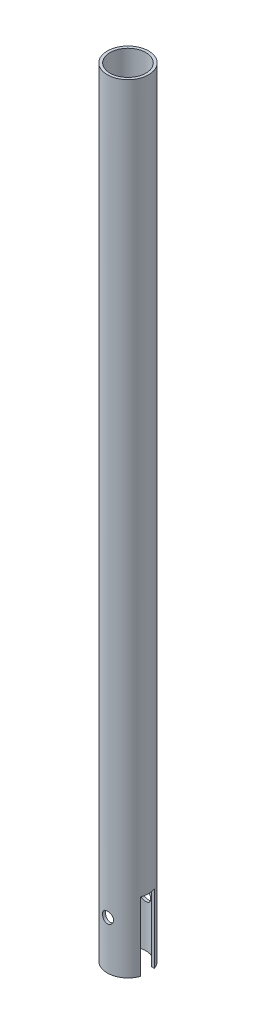
from build123d import *

# Parameters (mm, degrees)
SKETCH1_R               = 15
SKETCH1_R_2             = 13
BOSS_EXTRUDE1_DEPTH     = 282.5
SKETCH3_W               = 10
SKETCH3_H               = 50
CUT_EXTRUDE1_DEPTH      = 282.5
CUT_EXTRUDE2_DEPTH      = 284.29534059
CUT_EXTRUDE2_DEPTH_BACK = 284.29534059
SKETCH4_R               = 4


with BuildPart() as part:
    # Sketch1 → Boss-Extrude1 (new, symmetric)
    with BuildSketch(Plane(origin=(0, 0, 0), x_dir=(1, 0, 0), z_dir=(0, 1, 0))):
        Circle(SKETCH1_R)
        Circle(SKETCH1_R_2, mode=Mode.SUBTRACT)
    extrude(amount=BOSS_EXTRUDE1_DEPTH, both=True)

    # Sketch3 → Cut-Extrude1 (cut, symmetric)
    with BuildSketch(Plane(origin=(0, 0, 0), x_dir=(0, 0, -1), z_dir=(1, 0, 0))):
        with Locations((0, -257.5)):
            Rectangle(SKETCH3_W, SKETCH3_H)
    extrude(amount=CUT_EXTRUDE1_DEPTH, both=True, mode=Mode.SUBTRACT)

    # Sketch4 → Cut-Extrude2 (cut, two sides: drawn at the far end of the back side and taken through both)
    with BuildSketch(Plane.XY.offset(-CUT_EXTRUDE2_DEPTH_BACK)):
        with Locations((0, -247.5)):
            Circle(SKETCH4_R)
    extrude(amount=CUT_EXTRUDE2_DEPTH + CUT_EXTRUDE2_DEPTH_BACK, mode=Mode.SUBTRACT)


solid = part.part
